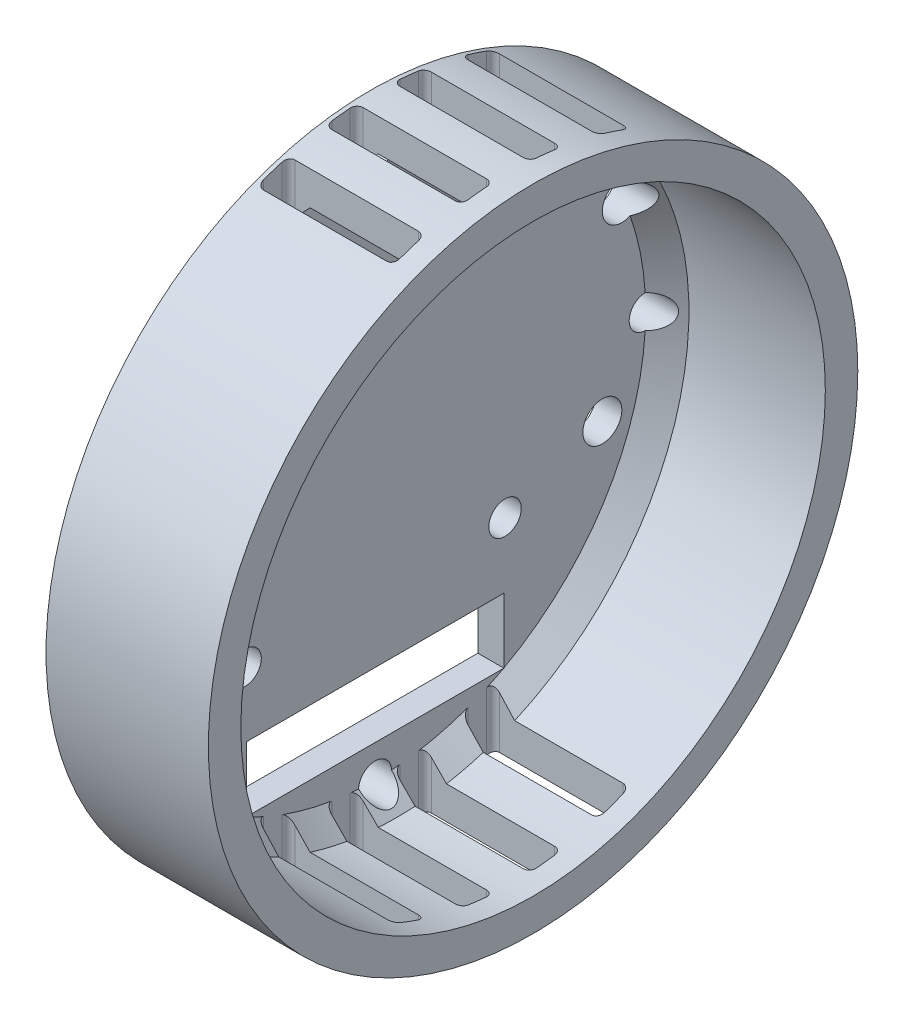
from build123d import *

# Parameters (mm, degrees)
SKETCH1_R                = 34.29
BOSS_EXTRUDE1_DEPTH      = 2.54
SKETCH2_R                = 38.1
BOSS_EXTRUDE2_DEPTH      = 0.508
SKETCH3_R                = 38.1
SKETCH3_R_2              = 34.29
BOSS_EXTRUDE3_DEPTH      = 18.542
SKETCH5_R                = 1.905
CUT_EXTRUDE1_DEPTH       = 57.982679509
SKETCH6_R                = 2.286
CUT_EXTRUDE10_DEPTH      = 57.982679509
CHAMFER2_SIZE            = 2.54
SKETCH7_W                = 12.7
SKETCH7_H                = 3.81
CUT_EXTRUDE11_DEPTH      = 57.982679509
CHAMFER3_SIZE            = 1.905
CUT_EXTRUDE12_DEPTH      = 57.982679509
CUT_EXTRUDE12_DEPTH_BACK = 57.982679509
SKETCH8_R                = 1.9304
CUT_EXTRUDE13_DEPTH      = 57.982679509
CUT_EXTRUDE13_DEPTH_BACK = 57.982679509
SKETCH9_W                = 7.62
SKETCH9_H                = 30.226
CUT_EXTRUDE14_DEPTH      = 57.982679509
CUT_EXTRUDE14_DEPTH_BACK = 57.982679509
SKETCH10_R               = 2.286
CUT_EXTRUDE15_DEPTH      = 80.240265648
CUT_EXTRUDE15_DEPTH_BACK = 80.240265648


with BuildPart() as part:
    # Sketch1 → Boss-Extrude1 (new body)
    with BuildSketch(Plane.YZ):
        with Locations(Location((0, 0, 0), (0, 0, 270))):
            Circle(SKETCH1_R)
    extrude(amount=BOSS_EXTRUDE1_DEPTH)

    # Sketch2 → Boss-Extrude2 (add)
    with BuildSketch(Plane.YZ.offset(2.54)):
        with Locations(Location((0, 0, 0), (0, 0, 270))):
            Circle(SKETCH2_R)
    extrude(amount=BOSS_EXTRUDE2_DEPTH)

    # Sketch3 → Boss-Extrude3 (add)
    with BuildSketch(Plane.YZ.offset(3.048)):
        with Locations(Location((0, 0, 0), (0, 0, 270))):
            Circle(SKETCH3_R)
        with Locations(Location((0, 0, 0), (0, 0, 270))):
            Circle(SKETCH3_R_2, mode=Mode.SUBTRACT)
    extrude(amount=BOSS_EXTRUDE3_DEPTH)

    # Sketch5 → Cut-Extrude1 (cut, through all)
    with BuildSketch(Plane.YZ.offset(3.048)):
        with Locations(Location((17.78999998, 15.25, 0), (0, 0, 270))):
            Circle(SKETCH5_R)
        with Locations(Location((17.79, -15.24999998, 0), (0, 0, 270))):
            Circle(SKETCH5_R)
        with Locations(Location((-12.70999998, -15.25, 0), (0, 0, 270))):
            Circle(SKETCH5_R)
        with Locations(Location((-12.71, 15.24999998, 0), (0, 0, 270))):
            Circle(SKETCH5_R)
    extrude(amount=-CUT_EXTRUDE1_DEPTH, mode=Mode.SUBTRACT)

    # Sketch6 → Cut-Extrude10 (cut, through all)
    with BuildSketch(Plane.YZ.offset(3.048)):
        with Locations(Location((28.956, 12.7, 0), (0, 0, 270))):
            Circle(SKETCH6_R)
        with Locations(Location((12.7, -28.956, 0), (0, 0, 270))):
            Circle(SKETCH6_R)
        with Locations(Location((-12.7, 28.956, 0), (0, 0, 270))):
            Circle(SKETCH6_R)
    extrude(amount=-CUT_EXTRUDE10_DEPTH, mode=Mode.SUBTRACT)

    # Chamfer2
    # the kernel refuses this chamfer: 2.54 mm, written as the material it adds along each edge
    with BuildSketch(Plane(origin=(3.048, 0, 0), x_dir=(0, 0, -1), z_dir=(0, -1, 0))) as chamfer2_piece_1_section:
        Polygon((34.29, CHAMFER2_SIZE), (34.29 - CHAMFER2_SIZE, 0), (34.29, 0), align=None)
    chamfer2_piece_1 = revolve(axis=Axis((3.048, 0, 0), (1, 0, 0)), mode=Mode.PRIVATE)
    chamfer2_piece_1 = chamfer2_piece_1 - Plane(origin=(4.254528557, 12.7, -28.956), x_dir=(0, 0, -1), z_dir=(1, 0, 0)) * Cylinder(2.286, 138, mode=Mode.PRIVATE)
    chamfer2_piece_1 = chamfer2_piece_1 - Plane(origin=(4.254528557, -12.7, 28.956), x_dir=(0, 0, -1), z_dir=(1, 0, 0)) * Cylinder(2.286, 138, mode=Mode.PRIVATE)
    chamfer2_piece_1 = chamfer2_piece_1 - Plane(origin=(4.254528557, 28.956, 12.7), x_dir=(0, 0, -1), z_dir=(1, 0, 0)) * Cylinder(2.286, 138, mode=Mode.PRIVATE)
    add(chamfer2_piece_1)

    # Sketch7 → Cut-Extrude11 (cut, through all)
    with BuildSketch(Plane.YZ.offset(3.048)):
        with Locations((14.285057548, 22.225)):
            Rectangle(SKETCH7_W, SKETCH7_H)
    extrude(amount=-CUT_EXTRUDE11_DEPTH, mode=Mode.SUBTRACT)

    # Chamfer3
    chamfer3_edges = [part.edges().sort_by_distance(p)[0] for p in [
        (2.54, 0, 34.29),
    ]]
    chamfer(chamfer3_edges, length=CHAMFER3_SIZE)

    # Sketch8 → Cut-Extrude12 (cut, two sides: drawn at the far end of the back side and taken through both)
    with BuildSketch(Plane.YZ.offset(3.048).offset(-CUT_EXTRUDE12_DEPTH_BACK)):
        with Locations(Location((0, -31.75, 0), (0, 0, 269.999999967))):
            Circle(SKETCH8_R)
        with Locations(Location((-31.75, 0, 0), (0, 0, 270))):
            Circle(SKETCH8_R)
        with Locations(Location((0, 31.75, 0), (0, 0, 270))):
            Circle(SKETCH8_R)
        with Locations(Location((31.75, 0, 0), (0, 0, 270))):
            Circle(SKETCH8_R)
    extrude(amount=CUT_EXTRUDE12_DEPTH + CUT_EXTRUDE12_DEPTH_BACK, mode=Mode.SUBTRACT)

    # Sketch9 → Cut-Extrude13 (cut, two sides: drawn at the far end of the back side and taken through both)
    with BuildSketch(Plane.YZ.offset(3.048).offset(-CUT_EXTRUDE13_DEPTH_BACK)):
        with Locations((-24.13, 0)):
            Rectangle(SKETCH9_W, SKETCH9_H)
    extrude(amount=CUT_EXTRUDE13_DEPTH + CUT_EXTRUDE13_DEPTH_BACK, mode=Mode.SUBTRACT)

    # Sketch10 → Cut-Extrude14 (cut, two sides: drawn at the far end of the back side and taken through both)
    with BuildSketch(Plane(origin=(3.048, 0, 0), x_dir=(0, 0, -1), z_dir=(1, 0, 0)).offset(-CUT_EXTRUDE14_DEPTH_BACK)):
        with Locations((26.67, -8.636)):
            Circle(SKETCH10_R)
    extrude(amount=CUT_EXTRUDE14_DEPTH + CUT_EXTRUDE14_DEPTH_BACK, mode=Mode.SUBTRACT)

    # Sketch11 → Cut-Extrude15 (cut, two sides: drawn at the far end of the back side and taken through both)
    with BuildSketch(Plane(origin=(0, -27.94, 0), x_dir=(-1, 0, 0), z_dir=(0, 1, 0)).offset(-CUT_EXTRUDE15_DEPTH_BACK)):
        with BuildLine():
            Line((-3.81, 13.843), (-18.288, 13.843))
            ThreePointArc((-18.288, 13.843), (-18.826815367, 13.619815367), (-19.05, 13.081))
            Line((-19.05, 13.081), (-19.05, 10.922))
            ThreePointArc((-19.05, 10.922), (-18.826815367, 10.383184633), (-18.288, 10.16))
            Line((-18.288, 10.16), (-3.81, 10.16))
            ThreePointArc((-3.81, 10.16), (-3.271184633, 10.383184633), (-3.048, 10.922))
            Line((-3.048, 10.922), (-3.048, 13.081))
            ThreePointArc((-3.048, 13.081), (-3.271184633, 13.619815367), (-3.81, 13.843))
        make_face()
        with BuildLine():
            Line((-3.81, 5.842), (-18.288, 5.842))
            ThreePointArc((-18.288, 5.842), (-18.826815367, 5.618815367), (-19.05, 5.08))
            Line((-19.05, 5.08), (-19.05, 2.921))
            ThreePointArc((-19.05, 2.921), (-18.826815367, 2.382184633), (-18.288, 2.159))
            Line((-18.288, 2.159), (-3.81, 2.159))
            ThreePointArc((-3.81, 2.159), (-3.271184633, 2.382184633), (-3.048, 2.921))
            Line((-3.048, 2.921), (-3.048, 5.08))
            ThreePointArc((-3.048, 5.08), (-3.271184633, 5.618815367), (-3.81, 5.842))
        make_face()
        with BuildLine():
            Line((-3.81, -2.159), (-18.288, -2.159))
            ThreePointArc((-18.288, -2.159), (-18.826815367, -2.382184633), (-19.05, -2.921))
            Line((-19.05, -2.921), (-19.05, -5.08))
            ThreePointArc((-19.05, -5.08), (-18.826815367, -5.618815367), (-18.288, -5.842))
            Line((-18.288, -5.842), (-3.81, -5.842))
            ThreePointArc((-3.81, -5.842), (-3.271184633, -5.618815367), (-3.048, -5.08))
            Line((-3.048, -5.08), (-3.048, -2.921))
            ThreePointArc((-3.048, -2.921), (-3.271184633, -2.382184633), (-3.81, -2.159))
        make_face()
        with BuildLine():
            Line((-3.81, -10.16), (-18.288, -10.16))
            ThreePointArc((-18.288, -10.16), (-18.826815367, -10.383184633), (-19.05, -10.922))
            Line((-19.05, -10.922), (-19.05, -13.081))
            ThreePointArc((-19.05, -13.081), (-18.826815367, -13.619815367), (-18.288, -13.843))
            Line((-18.288, -13.843), (-3.81, -13.843))
            ThreePointArc((-3.81, -13.843), (-3.271184633, -13.619815367), (-3.048, -13.081))
            Line((-3.048, -13.081), (-3.048, -10.922))
            ThreePointArc((-3.048, -10.922), (-3.271184633, -10.383184633), (-3.81, -10.16))
        make_face()
    extrude(amount=CUT_EXTRUDE15_DEPTH + CUT_EXTRUDE15_DEPTH_BACK, mode=Mode.SUBTRACT)


solid = part.part
